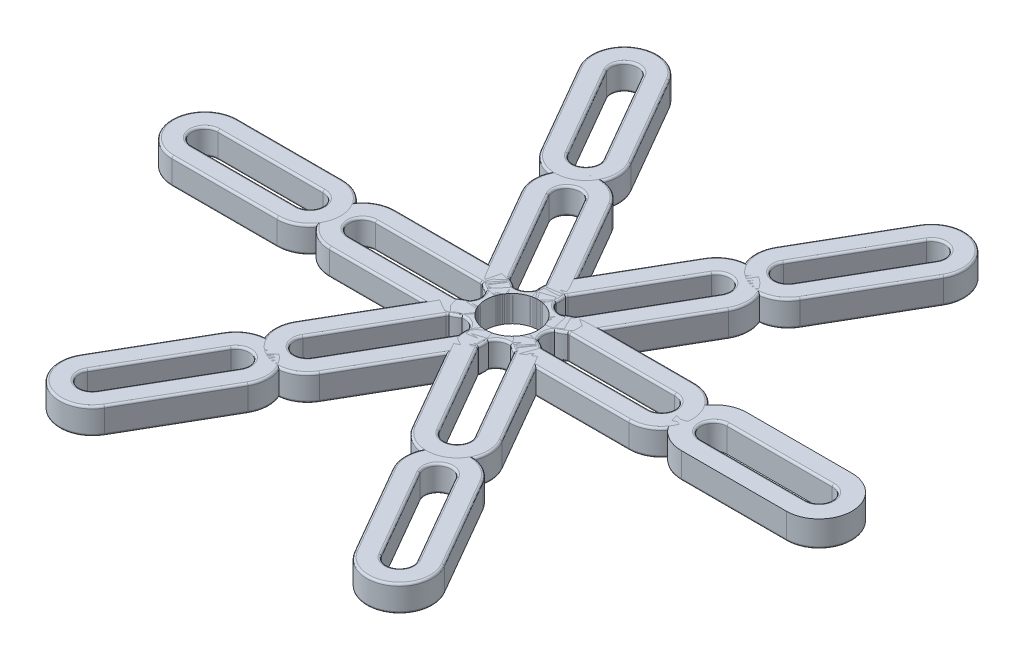
from build123d import *

# Parameters (mm, degrees)
EXTRUDE_THIN1_DEPTH    = 3.175
EXTRUDE_THIN1_2_DEPTH  = 3.175
EXTRUDE_THIN1_3_DEPTH  = 3.175
EXTRUDE_THIN1_4_DEPTH  = 3.175
EXTRUDE_THIN1_5_DEPTH  = 3.175
EXTRUDE_THIN1_6_DEPTH  = 3.175
EXTRUDE_THIN1_7_DEPTH  = 3.175
EXTRUDE_THIN1_8_DEPTH  = 3.175
EXTRUDE_THIN1_9_DEPTH  = 3.175
EXTRUDE_THIN1_10_DEPTH = 3.175
EXTRUDE_THIN1_11_DEPTH = 3.175
EXTRUDE_THIN1_12_DEPTH = 3.175
SKETCH3_R              = 3.175
CUT_EXTRUDE1_DEPTH     = 3.175
FILLET3_R              = 0.254
FILLET4_R              = 0.254
FILLET5_R              = 0.254
FILLET6_R              = 0.254
FILLET7_R              = 0.254
FILLET8_R              = 0.254
FILLET9_R              = 0.254
FILLET10_R             = 0.254
FILLET11_R             = 0.254
FILLET12_R             = 0.254
FILLET13_R             = 0.254
FILLET14_R             = 0.254


with BuildPart() as part:
    # Sketch2 → Extrude-Thin1 (new body)
    with BuildSketch(Plane(origin=(0, 0, 0), x_dir=(1, 0, 0), z_dir=(0, 1, 0))):
        with BuildLine():
            Line((18.0975, -3.9751), (5.3975, -3.9751))
            ThreePointArc((5.3975, -3.9751), (1.4224, 0), (5.3975, 3.9751))
            Line((5.3975, 3.9751), (18.0975, 3.9751))
            ThreePointArc((18.0975, 3.9751), (22.0726, 0), (18.0975, -3.9751))
        make_face()
        with BuildLine():
            Line((18.0975, -1.5875), (5.3975, -1.5875))
            ThreePointArc((5.3975, -1.5875), (3.81, 0), (5.3975, 1.5875))
            Line((5.3975, 1.5875), (18.0975, 1.5875))
            ThreePointArc((18.0975, 1.5875), (19.685, 0), (18.0975, -1.5875))
        make_face(mode=Mode.SUBTRACT)
    extrude(amount=EXTRUDE_THIN1_DEPTH)


with BuildPart() as body_2:
    # Sketch2 → Extrude-Thin1 2 (new body)
    with BuildSketch(Plane(origin=(0, 0, 0), x_dir=(1, 0, 0), z_dir=(0, 1, 0))):
        with BuildLine():
            Line((24.4475, -3.9751), (37.1475, -3.9751))
            ThreePointArc((37.1475, -3.9751), (41.1226, 0), (37.1475, 3.9751))
            Line((37.1475, 3.9751), (24.4475, 3.9751))
            ThreePointArc((24.4475, 3.9751), (20.4724, 0), (24.4475, -3.9751))
        make_face()
        with BuildLine():
            Line((24.4475, -1.5875), (37.1475, -1.5875))
            ThreePointArc((37.1475, -1.5875), (38.735, 0), (37.1475, 1.5875))
            Line((37.1475, 1.5875), (24.4475, 1.5875))
            ThreePointArc((24.4475, 1.5875), (22.86, 0), (24.4475, -1.5875))
        make_face(mode=Mode.SUBTRACT)
    extrude(amount=EXTRUDE_THIN1_2_DEPTH)

    # Fillet4
    fillet4_edges = [body_2.edges().sort_by_distance(p)[0] for p in [
        (30.7975, 0, -3.9751),
        (20.4724, 0, 0),
        (30.7975, 0, 3.9751),
        (41.1226, 0, 0),
        (30.7975, 3.175, -1.5875),
        (22.86, 3.175, 0),
        (30.7975, 3.175, 1.5875),
        (38.735, 3.175, 0),
    ]]
    fillet(fillet4_edges, radius=FILLET4_R)


with BuildPart() as body_3:
    # Sketch2 → Extrude-Thin1 3 (new body)
    with BuildSketch(Plane(origin=(0, 0, 0), x_dir=(1, 0, 0), z_dir=(0, 1, 0))):
        with BuildLine():
            Line((5.606212417, -17.660444745), (-0.743787583, -6.661922117))
            ThreePointArc((-0.743787583, -6.661922117), (0.7112, -1.231834534), (6.141287583, -2.686822117))
            Line((6.141287583, -2.686822117), (12.491287583, -13.685344745))
            ThreePointArc((12.491287583, -13.685344745), (11.0363, -19.115432328), (5.606212417, -17.660444745))
        make_face()
        with BuildLine():
            Line((7.673934671, -16.466644745), (1.323934671, -5.468122117))
            ThreePointArc((1.323934671, -5.468122117), (1.905, -3.299556788), (4.073565329, -3.880622117))
            Line((4.073565329, -3.880622117), (10.423565329, -14.879144745))
            ThreePointArc((10.423565329, -14.879144745), (9.8425, -17.047710073), (7.673934671, -16.466644745))
        make_face(mode=Mode.SUBTRACT)
    extrude(amount=EXTRUDE_THIN1_3_DEPTH)


with BuildPart() as body_4:
    # Sketch2 → Extrude-Thin1 4 (new body)
    with BuildSketch(Plane(origin=(0, 0, 0), x_dir=(1, 0, 0), z_dir=(0, 1, 0))):
        with BuildLine():
            Line((8.781212417, -23.159706059), (15.131212417, -34.158228687))
            ThreePointArc((15.131212417, -34.158228687), (20.5613, -35.61321627), (22.016287583, -30.183128687))
            Line((22.016287583, -30.183128687), (15.666287583, -19.184606059))
            ThreePointArc((15.666287583, -19.184606059), (10.2362, -17.729618476), (8.781212417, -23.159706059))
        make_face()
        with BuildLine():
            Line((10.848934671, -21.965906059), (17.198934671, -32.964428687))
            ThreePointArc((17.198934671, -32.964428687), (19.3675, -33.545494016), (19.948565329, -31.376928687))
            Line((19.948565329, -31.376928687), (13.598565329, -20.378406059))
            ThreePointArc((13.598565329, -20.378406059), (11.43, -19.797340731), (10.848934671, -21.965906059))
        make_face(mode=Mode.SUBTRACT)
    extrude(amount=EXTRUDE_THIN1_4_DEPTH)

    # Fillet14
    fillet14_edges = [body_4.edges().sort_by_distance(p)[0] for p in [
        (20.5613, 3.175, 35.61321627),
        (11.956212417, 3.175, 28.658967373),
        (10.2362, 3.175, 17.729618476),
        (19.3675, 3.175, 33.545494016),
        (14.023934671, 3.175, 27.465167373),
        (11.43, 3.175, 19.797340731),
        (10.2362, 0, 17.729618476),
        (18.841287583, 0, 24.683867373),
        (20.5613, 0, 35.61321627),
        (11.43, 0, 19.797340731),
        (16.773565329, 0, 25.877667373),
        (19.3675, 0, 33.545494016),
        (18.841287583, 3.175, 24.683867373),
        (16.773565329, 3.175, 25.877667373),
        (11.956212417, 0, 28.658967373),
        (14.023934671, 0, 27.465167373),
    ]]
    fillet(fillet14_edges, radius=FILLET14_R)


with BuildPart() as body_5:
    # Sketch2 → Extrude-Thin1 5 (new body)
    with BuildSketch(Plane(origin=(0, 0, 0), x_dir=(1, 0, 0), z_dir=(0, 1, 0))):
        with BuildLine():
            Line((-12.491287583, -13.685344745), (-6.141287583, -2.686822117))
            ThreePointArc((-6.141287583, -2.686822117), (-0.7112, -1.231834534), (0.743787583, -6.661922117))
            Line((0.743787583, -6.661922117), (-5.606212417, -17.660444745))
            ThreePointArc((-5.606212417, -17.660444745), (-11.0363, -19.115432328), (-12.491287583, -13.685344745))
        make_face()
        with BuildLine():
            Line((-10.423565329, -14.879144745), (-4.073565329, -3.880622117))
            ThreePointArc((-4.073565329, -3.880622117), (-1.905, -3.299556788), (-1.323934671, -5.468122117))
            Line((-1.323934671, -5.468122117), (-7.673934671, -16.466644745))
            ThreePointArc((-7.673934671, -16.466644745), (-9.8425, -17.047710073), (-10.423565329, -14.879144745))
        make_face(mode=Mode.SUBTRACT)
    extrude(amount=EXTRUDE_THIN1_5_DEPTH)


with BuildPart() as body_6:
    # Sketch2 → Extrude-Thin1 6 (new body)
    with BuildSketch(Plane(origin=(0, 0, 0), x_dir=(1, 0, 0), z_dir=(0, 1, 0))):
        with BuildLine():
            Line((-15.666287583, -19.184606059), (-22.016287583, -30.183128687))
            ThreePointArc((-22.016287583, -30.183128687), (-20.5613, -35.61321627), (-15.131212417, -34.158228687))
            Line((-15.131212417, -34.158228687), (-8.781212417, -23.159706059))
            ThreePointArc((-8.781212417, -23.159706059), (-10.2362, -17.729618476), (-15.666287583, -19.184606059))
        make_face()
        with BuildLine():
            Line((-13.598565329, -20.378406059), (-19.948565329, -31.376928687))
            ThreePointArc((-19.948565329, -31.376928687), (-19.3675, -33.545494016), (-17.198934671, -32.964428687))
            Line((-17.198934671, -32.964428687), (-10.848934671, -21.965906059))
            ThreePointArc((-10.848934671, -21.965906059), (-11.43, -19.797340731), (-13.598565329, -20.378406059))
        make_face(mode=Mode.SUBTRACT)
    extrude(amount=EXTRUDE_THIN1_6_DEPTH)

    # Fillet12
    fillet12_edges = [body_6.edges().sort_by_distance(p)[0] for p in [
        (-19.3675, 3.175, 33.545494016),
        (-16.773565329, 3.175, 25.877667373),
        (-11.43, 3.175, 19.797340731),
        (-20.5613, 3.175, 35.61321627),
        (-18.841287583, 3.175, 24.683867373),
        (-10.2362, 3.175, 17.729618476),
        (-20.5613, 0, 35.61321627),
        (-18.841287583, 0, 24.683867373),
        (-10.2362, 0, 17.729618476),
        (-11.43, 0, 19.797340731),
        (-14.023934671, 0, 27.465167373),
        (-19.3675, 0, 33.545494016),
        (-14.023934671, 3.175, 27.465167373),
        (-11.956212417, 3.175, 28.658967373),
        (-11.956212417, 0, 28.658967373),
        (-16.773565329, 0, 25.877667373),
    ]]
    fillet(fillet12_edges, radius=FILLET12_R)


with BuildPart() as body_7:
    # Sketch2 → Extrude-Thin1 7 (new body)
    with BuildSketch(Plane(origin=(0, 0, 0), x_dir=(1, 0, 0), z_dir=(0, 1, 0))):
        with BuildLine():
            Line((-18.0975, 3.9751), (-5.3975, 3.9751))
            ThreePointArc((-5.3975, 3.9751), (-1.4224, 0), (-5.3975, -3.9751))
            Line((-5.3975, -3.9751), (-18.0975, -3.9751))
            ThreePointArc((-18.0975, -3.9751), (-22.0726, 0), (-18.0975, 3.9751))
        make_face()
        with BuildLine():
            Line((-18.0975, 1.5875), (-5.3975, 1.5875))
            ThreePointArc((-5.3975, 1.5875), (-3.81, 0), (-5.3975, -1.5875))
            Line((-5.3975, -1.5875), (-18.0975, -1.5875))
            ThreePointArc((-18.0975, -1.5875), (-19.685, 0), (-18.0975, 1.5875))
        make_face(mode=Mode.SUBTRACT)
    extrude(amount=EXTRUDE_THIN1_7_DEPTH)


with BuildPart() as body_8:
    # Sketch2 → Extrude-Thin1 8 (new body)
    with BuildSketch(Plane(origin=(0, 0, 0), x_dir=(1, 0, 0), z_dir=(0, 1, 0))):
        with BuildLine():
            Line((-24.4475, 3.9751), (-37.1475, 3.9751))
            ThreePointArc((-37.1475, 3.9751), (-41.1226, 0), (-37.1475, -3.9751))
            Line((-37.1475, -3.9751), (-24.4475, -3.9751))
            ThreePointArc((-24.4475, -3.9751), (-20.4724, 0), (-24.4475, 3.9751))
        make_face()
        with BuildLine():
            Line((-24.4475, 1.5875), (-37.1475, 1.5875))
            ThreePointArc((-37.1475, 1.5875), (-38.735, 0), (-37.1475, -1.5875))
            Line((-37.1475, -1.5875), (-24.4475, -1.5875))
            ThreePointArc((-24.4475, -1.5875), (-22.86, 0), (-24.4475, 1.5875))
        make_face(mode=Mode.SUBTRACT)
    extrude(amount=EXTRUDE_THIN1_8_DEPTH)

    # Fillet10
    fillet10_edges = [body_8.edges().sort_by_distance(p)[0] for p in [
        (-38.735, 3.175, 0),
        (-30.7975, 3.175, -1.5875),
        (-22.86, 3.175, 0),
        (-41.1226, 3.175, 0),
        (-30.7975, 3.175, -3.9751),
        (-20.4724, 3.175, 0),
        (-41.1226, 0, 0),
        (-30.7975, 0, -3.9751),
        (-20.4724, 0, 0),
        (-38.735, 0, 0),
        (-30.7975, 0, -1.5875),
        (-22.86, 0, 0),
        (-30.7975, 3.175, 1.5875),
        (-30.7975, 3.175, 3.9751),
        (-30.7975, 0, 3.9751),
        (-30.7975, 0, 1.5875),
    ]]
    fillet(fillet10_edges, radius=FILLET10_R)


with BuildPart() as body_9:
    # Sketch2 → Extrude-Thin1 9 (new body)
    with BuildSketch(Plane(origin=(0, 0, 0), x_dir=(1, 0, 0), z_dir=(0, 1, 0))):
        with BuildLine():
            Line((-5.606212417, 17.660444745), (0.743787583, 6.661922117))
            ThreePointArc((0.743787583, 6.661922117), (-0.7112, 1.231834534), (-6.141287583, 2.686822117))
            Line((-6.141287583, 2.686822117), (-12.491287583, 13.685344745))
            ThreePointArc((-12.491287583, 13.685344745), (-11.0363, 19.115432328), (-5.606212417, 17.660444745))
        make_face()
        with BuildLine():
            Line((-7.673934671, 16.466644745), (-1.323934671, 5.468122117))
            ThreePointArc((-1.323934671, 5.468122117), (-1.905, 3.299556788), (-4.073565329, 3.880622117))
            Line((-4.073565329, 3.880622117), (-10.423565329, 14.879144745))
            ThreePointArc((-10.423565329, 14.879144745), (-9.8425, 17.047710073), (-7.673934671, 16.466644745))
        make_face(mode=Mode.SUBTRACT)
    extrude(amount=EXTRUDE_THIN1_9_DEPTH)


with BuildPart() as body_10:
    # Sketch2 → Extrude-Thin1 10 (new body)
    with BuildSketch(Plane(origin=(0, 0, 0), x_dir=(1, 0, 0), z_dir=(0, 1, 0))):
        with BuildLine():
            Line((-8.781212417, 23.159706059), (-15.131212417, 34.158228687))
            ThreePointArc((-15.131212417, 34.158228687), (-20.5613, 35.61321627), (-22.016287583, 30.183128687))
            Line((-22.016287583, 30.183128687), (-15.666287583, 19.184606059))
            ThreePointArc((-15.666287583, 19.184606059), (-10.2362, 17.729618476), (-8.781212417, 23.159706059))
        make_face()
        with BuildLine():
            Line((-10.848934671, 21.965906059), (-17.198934671, 32.964428687))
            ThreePointArc((-17.198934671, 32.964428687), (-19.3675, 33.545494016), (-19.948565329, 31.376928687))
            Line((-19.948565329, 31.376928687), (-13.598565329, 20.378406059))
            ThreePointArc((-13.598565329, 20.378406059), (-11.43, 19.797340731), (-10.848934671, 21.965906059))
        make_face(mode=Mode.SUBTRACT)
    extrude(amount=EXTRUDE_THIN1_10_DEPTH)

    # Fillet8
    fillet8_edges = [body_10.edges().sort_by_distance(p)[0] for p in [
        (-11.43, 3.175, -19.797340731),
        (-16.773565329, 3.175, -25.877667373),
        (-19.3675, 3.175, -33.545494016),
        (-10.2362, 3.175, -17.729618476),
        (-18.841287583, 3.175, -24.683867373),
        (-20.5613, 3.175, -35.61321627),
        (-10.2362, 0, -17.729618476),
        (-18.841287583, 0, -24.683867373),
        (-20.5613, 0, -35.61321627),
        (-11.43, 0, -19.797340731),
        (-16.773565329, 0, -25.877667373),
        (-19.3675, 0, -33.545494016),
        (-14.023934671, 3.175, -27.465167373),
        (-11.956212417, 3.175, -28.658967373),
        (-11.956212417, 0, -28.658967373),
        (-14.023934671, 0, -27.465167373),
    ]]
    fillet(fillet8_edges, radius=FILLET8_R)


with BuildPart() as body_11:
    # Sketch2 → Extrude-Thin1 11 (new body)
    with BuildSketch(Plane(origin=(0, 0, 0), x_dir=(1, 0, 0), z_dir=(0, 1, 0))):
        with BuildLine():
            Line((12.491287583, 13.685344745), (6.141287583, 2.686822117))
            ThreePointArc((6.141287583, 2.686822117), (0.7112, 1.231834534), (-0.743787583, 6.661922117))
            Line((-0.743787583, 6.661922117), (5.606212417, 17.660444745))
            ThreePointArc((5.606212417, 17.660444745), (11.0363, 19.115432328), (12.491287583, 13.685344745))
        make_face()
        with BuildLine():
            Line((10.423565329, 14.879144745), (4.073565329, 3.880622117))
            ThreePointArc((4.073565329, 3.880622117), (1.905, 3.299556788), (1.323934671, 5.468122117))
            Line((1.323934671, 5.468122117), (7.673934671, 16.466644745))
            ThreePointArc((7.673934671, 16.466644745), (9.8425, 17.047710073), (10.423565329, 14.879144745))
        make_face(mode=Mode.SUBTRACT)
    extrude(amount=EXTRUDE_THIN1_11_DEPTH)


with BuildPart() as body_12:
    # Sketch2 → Extrude-Thin1 12 (new body)
    with BuildSketch(Plane(origin=(0, 0, 0), x_dir=(1, 0, 0), z_dir=(0, 1, 0))):
        with BuildLine():
            Line((15.666287583, 19.184606059), (22.016287583, 30.183128687))
            ThreePointArc((22.016287583, 30.183128687), (20.5613, 35.61321627), (15.131212417, 34.158228687))
            Line((15.131212417, 34.158228687), (8.781212417, 23.159706059))
            ThreePointArc((8.781212417, 23.159706059), (10.2362, 17.729618476), (15.666287583, 19.184606059))
        make_face()
        with BuildLine():
            Line((13.598565329, 20.378406059), (19.948565329, 31.376928687))
            ThreePointArc((19.948565329, 31.376928687), (19.3675, 33.545494016), (17.198934671, 32.964428687))
            Line((17.198934671, 32.964428687), (10.848934671, 21.965906059))
            ThreePointArc((10.848934671, 21.965906059), (11.43, 19.797340731), (13.598565329, 20.378406059))
        make_face(mode=Mode.SUBTRACT)
    extrude(amount=EXTRUDE_THIN1_12_DEPTH)

    # Fillet6
    fillet6_edges = [body_12.edges().sort_by_distance(p)[0] for p in [
        (19.3675, 3.175, -33.545494016),
        (16.773565329, 3.175, -25.877667373),
        (11.43, 3.175, -19.797340731),
        (20.5613, 3.175, -35.61321627),
        (18.841287583, 3.175, -24.683867373),
        (10.2362, 3.175, -17.729618476),
        (10.2362, 0, -17.729618476),
        (11.956212417, 0, -28.658967373),
        (20.5613, 0, -35.61321627),
        (11.43, 0, -19.797340731),
        (14.023934671, 0, -27.465167373),
        (19.3675, 0, -33.545494016),
        (14.023934671, 3.175, -27.465167373),
        (11.956212417, 3.175, -28.658967373),
        (18.841287583, 0, -24.683867373),
        (16.773565329, 0, -25.877667373),
    ]]
    fillet(fillet6_edges, radius=FILLET6_R)


with BuildPart() as cut_extrude1_tool:
    # Sketch3 → Cut-Extrude1 (new body)
    with BuildSketch(Plane(origin=(0, 0, 0), x_dir=(1, 0, 0), z_dir=(0, 1, 0))):
        Circle(SKETCH3_R)
    extrude(amount=CUT_EXTRUDE1_DEPTH)


with BuildPart() as part_1:
    add(part.part)

    # Cut-Extrude1: cut by cut_extrude1_tool
    add(cut_extrude1_tool.part, mode=Mode.SUBTRACT)

    # Fillet3
    fillet3_edges = [part_1.edges().sort_by_distance(p)[0] for p in [
        (3.81, 0, 0),
        (11.7475, 0, -1.5875),
        (19.685, 0, 0),
        (3.583129686, 0, 3.536874379),
        (3.583129686, 0, -3.536874379),
        (11.7475, 0, -3.9751),
        (22.0726, 0, 0),
        (3.583129686, 3.175, 3.536874379),
        (11.7475, 3.175, 3.9751),
        (22.0726, 3.175, 0),
        (3.583129686, 3.175, -3.536874379),
        (3.81, 3.175, 0),
        (11.7475, 3.175, -1.5875),
        (19.685, 3.175, 0),
        (11.7475, 0, 1.5875),
        (11.7475, 0, 3.9751),
        (11.7475, 3.175, -3.9751),
        (11.7475, 3.175, 1.5875),
    ]]
    fillet(fillet3_edges, radius=FILLET3_R)


with BuildPart() as body_3_1:
    add(body_3.part)

    # Cut-Extrude1: cut by cut_extrude1_tool
    add(cut_extrude1_tool.part, mode=Mode.SUBTRACT)

    # Fillet13
    fillet13_edges = [body_3_1.edges().sort_by_distance(p)[0] for p in [
        (1.905, 0, 3.299556788),
        (7.248565329, 0, 9.379883431),
        (9.8425, 0, 17.047710073),
        (-1.271458219, 0, 4.871518522),
        (4.854587905, 0, 1.334644143),
        (9.316287583, 0, 8.186083431),
        (11.0363, 0, 19.115432328),
        (-1.271458219, 3.175, 4.871518522),
        (4.854587905, 3.175, 1.334644143),
        (9.316287583, 3.175, 8.186083431),
        (11.0363, 3.175, 19.115432328),
        (1.905, 3.175, 3.299556788),
        (7.248565329, 3.175, 9.379883431),
        (9.8425, 3.175, 17.047710073),
        (4.498934671, 0, 10.967383431),
        (2.431212417, 0, 12.161183431),
        (2.431212417, 3.175, 12.161183431),
        (4.498934671, 3.175, 10.967383431),
    ]]
    fillet(fillet13_edges, radius=FILLET13_R)


with BuildPart() as body_5_1:
    add(body_5.part)

    # Cut-Extrude1: cut by cut_extrude1_tool
    add(cut_extrude1_tool.part, mode=Mode.SUBTRACT)

    # Fillet11
    fillet11_edges = [body_5_1.edges().sort_by_distance(p)[0] for p in [
        (-9.8425, 0, 17.047710073),
        (-7.248565329, 0, 9.379883431),
        (-1.905, 0, 3.299556788),
        (-4.854587905, 0, 1.334644143),
        (-9.316287583, 0, 8.186083431),
        (-11.0363, 0, 19.115432328),
        (1.271458219, 0, 4.871518522),
        (-4.854587905, 3.175, 1.334644143),
        (-9.316287583, 3.175, 8.186083431),
        (-11.0363, 3.175, 19.115432328),
        (1.271458219, 3.175, 4.871518522),
        (-1.905, 3.175, 3.299556788),
        (-4.498934671, 3.175, 10.967383431),
        (-9.8425, 3.175, 17.047710073),
        (-4.498934671, 0, 10.967383431),
        (-2.431212417, 0, 12.161183431),
        (-2.431212417, 3.175, 12.161183431),
        (-7.248565329, 3.175, 9.379883431),
    ]]
    fillet(fillet11_edges, radius=FILLET11_R)


with BuildPart() as body_7_1:
    add(body_7.part)

    # Cut-Extrude1: cut by cut_extrude1_tool
    add(cut_extrude1_tool.part, mode=Mode.SUBTRACT)

    # Fillet9
    fillet9_edges = [body_7_1.edges().sort_by_distance(p)[0] for p in [
        (-3.583129686, 0, -3.536874379),
        (-11.7475, 0, -3.9751),
        (-22.0726, 0, 0),
        (-3.583129686, 0, 3.536874379),
        (-3.81, 0, 0),
        (-11.7475, 0, 1.5875),
        (-19.685, 0, 0),
        (-3.583129686, 3.175, -3.536874379),
        (-11.7475, 3.175, -3.9751),
        (-22.0726, 3.175, 0),
        (-3.583129686, 3.175, 3.536874379),
        (-19.685, 3.175, 0),
        (-11.7475, 3.175, -1.5875),
        (-3.81, 3.175, 0),
        (-11.7475, 0, 3.9751),
        (-11.7475, 0, -1.5875),
        (-11.7475, 3.175, 3.9751),
        (-11.7475, 3.175, 1.5875),
    ]]
    fillet(fillet9_edges, radius=FILLET9_R)


with BuildPart() as body_9_1:
    add(body_9.part)

    # Cut-Extrude1: cut by cut_extrude1_tool
    add(cut_extrude1_tool.part, mode=Mode.SUBTRACT)

    # Fillet7
    fillet7_edges = [body_9_1.edges().sort_by_distance(p)[0] for p in [
        (-1.905, 0, -3.299556788),
        (-7.248565329, 0, -9.379883431),
        (-9.8425, 0, -17.047710073),
        (1.271458219, 0, -4.871518522),
        (-4.854587905, 0, -1.334644143),
        (-9.316287583, 0, -8.186083431),
        (-11.0363, 0, -19.115432328),
        (1.271458219, 3.175, -4.871518522),
        (-4.854587905, 3.175, -1.334644143),
        (-9.316287583, 3.175, -8.186083431),
        (-11.0363, 3.175, -19.115432328),
        (-1.905, 3.175, -3.299556788),
        (-7.248565329, 3.175, -9.379883431),
        (-9.8425, 3.175, -17.047710073),
        (-4.498934671, 0, -10.967383431),
        (-2.431212417, 0, -12.161183431),
        (-2.431212417, 3.175, -12.161183431),
        (-4.498934671, 3.175, -10.967383431),
    ]]
    fillet(fillet7_edges, radius=FILLET7_R)


with BuildPart() as body_11_1:
    add(body_11.part)

    # Cut-Extrude1: cut by cut_extrude1_tool
    add(cut_extrude1_tool.part, mode=Mode.SUBTRACT)

    # Fillet5
    fillet5_edges = [body_11_1.edges().sort_by_distance(p)[0] for p in [
        (4.854587905, 0, -1.334644143),
        (-1.271458219, 0, -4.871518522),
        (2.431212417, 0, -12.161183431),
        (11.0363, 0, -19.115432328),
        (1.905, 0, -3.299556788),
        (4.498934671, 0, -10.967383431),
        (9.8425, 0, -17.047710073),
        (4.854587905, 3.175, -1.334644143),
        (-1.271458219, 3.175, -4.871518522),
        (2.431212417, 3.175, -12.161183431),
        (11.0363, 3.175, -19.115432328),
        (9.8425, 3.175, -17.047710073),
        (7.248565329, 3.175, -9.379883431),
        (1.905, 3.175, -3.299556788),
        (9.316287583, 0, -8.186083431),
        (7.248565329, 0, -9.379883431),
        (9.316287583, 3.175, -8.186083431),
        (4.498934671, 3.175, -10.967383431),
    ]]
    fillet(fillet5_edges, radius=FILLET5_R)


solid = Compound([body_2.part, body_4.part, body_6.part, body_8.part, body_10.part, body_12.part, part_1.part, body_3_1.part, body_5_1.part, body_7_1.part, body_9_1.part, body_11_1.part])
